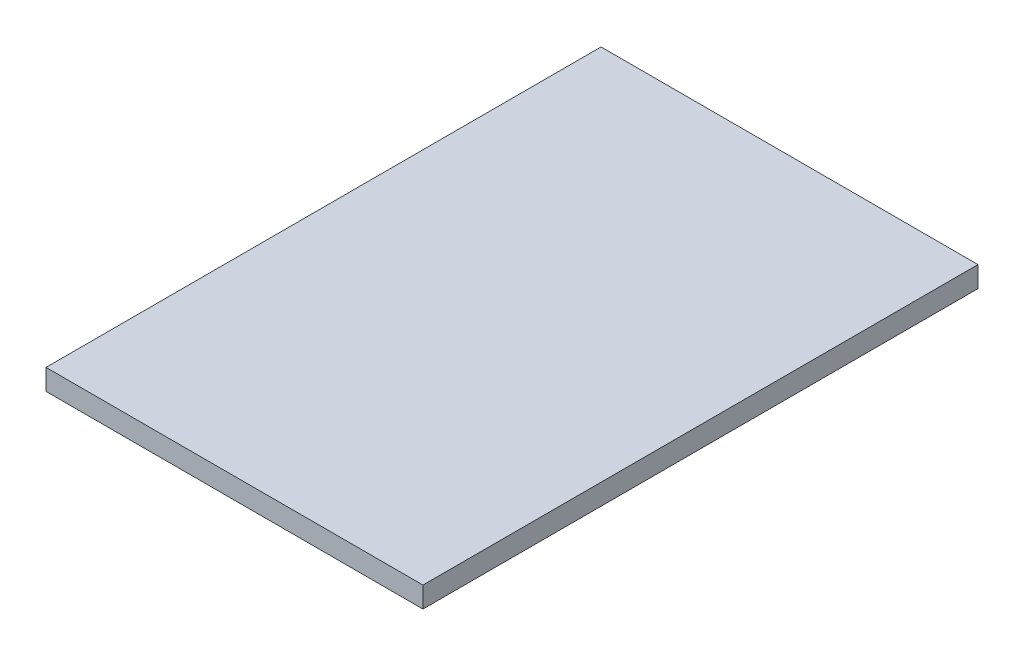
from build123d import *

# Parameters (mm, degrees)
SKETCH1_W           = 163
SKETCH1_H           = 240
BOSS_EXTRUDE1_DEPTH = 9


with BuildPart() as part:
    # Sketch1 → Boss-Extrude1 (new body)
    with BuildSketch(Plane(origin=(0, 0, 0), x_dir=(1, 0, 0), z_dir=(0, 1, 0))):
        Rectangle(SKETCH1_W, SKETCH1_H)
    extrude(amount=BOSS_EXTRUDE1_DEPTH)


solid = part.part
